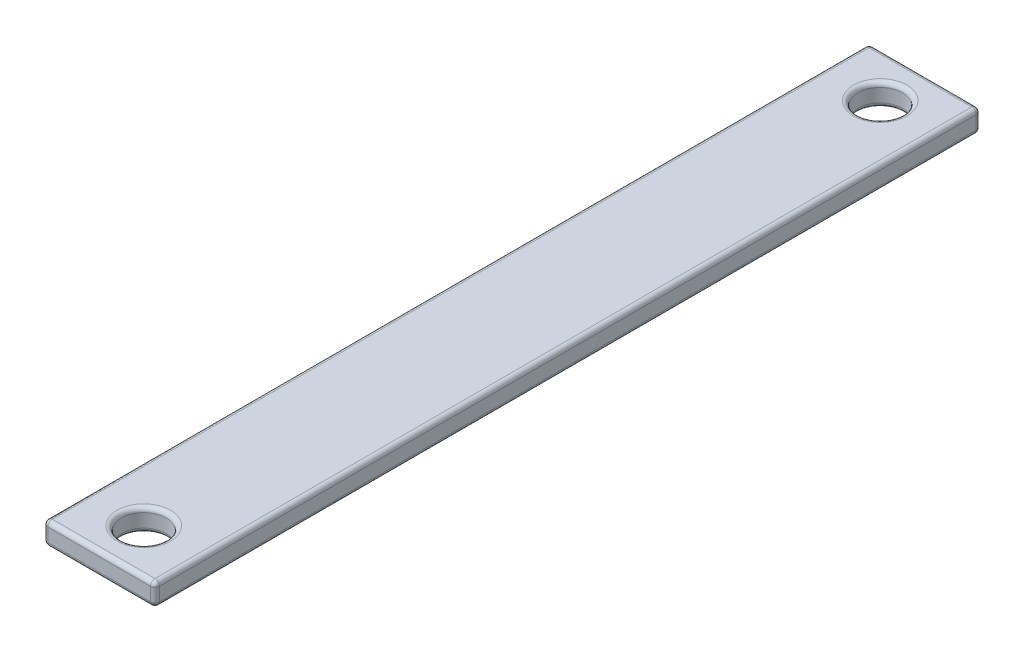
from build123d import *

# Parameters (mm, degrees)
CROQUIS1_W              = 50
CROQUIS1_H              = 370
CROQUIS1_R              = 10
SALIENTE_EXTRUIR1_DEPTH = 10
REDONDEO1_R             = 2
REDONDEO2_R             = 2


with BuildPart() as part:
    # Croquis1 → Saliente-Extruir1 (new body)
    with BuildSketch(Plane(origin=(0, 0, 0), x_dir=(1, 0, 0), z_dir=(0, 1, 0))):
        Rectangle(CROQUIS1_W, CROQUIS1_H)
        with Locations(Location((0, 165, 0), (0, 0, 270))):
            Circle(CROQUIS1_R, mode=Mode.SUBTRACT)
        with Locations(Location((0, -165, 0), (0, 0, 90))):
            Circle(CROQUIS1_R, mode=Mode.SUBTRACT)
    extrude(amount=SALIENTE_EXTRUIR1_DEPTH)

    # Redondeo1
    redondeo1_edges = [part.edges().sort_by_distance(p)[0] for p in [
        (0, 0, -175),
        (0, 10, -175),
        (-25, 10, 0),
        (0, 0, 175),
        (0, 10, 175),
        (0, 10, 185),
        (25, 10, 0),
        (0, 0, 185),
        (-25, 0, 0),
        (0, 0, -185),
        (25, 0, 0),
        (0, 10, -185),
    ]]
    fillet(redondeo1_edges, radius=REDONDEO1_R)

    # Redondeo2
    # the kernel refuses this fillet: 2 mm, written as the material it takes off along each edge
    with BuildSketch(Plane(origin=(-23, 8, -183), x_dir=(0, 0, -1), z_dir=(-1, 0, 0))) as redondeo2_piece_1_section:
        Polygon((0, 0), (REDONDEO2_R, 0), (REDONDEO2_R, -REDONDEO2_R), (0, -REDONDEO2_R), align=None)
    redondeo2_piece_1 = extrude(amount=REDONDEO2_R, mode=Mode.PRIVATE)
    redondeo2_piece_1 = redondeo2_piece_1 - Plane(origin=(-23, 8, -183), x_dir=(0, -0.7071067811865475, 0.7071067811865475), z_dir=(-1, 0, 0)) * Sphere(REDONDEO2_R, mode=Mode.PRIVATE)
    add(redondeo2_piece_1, mode=Mode.SUBTRACT)
    with BuildSketch(Plane(origin=(23, 8, -183), x_dir=(0, 0, -1), z_dir=(1, 0, 0))) as redondeo2_piece_2_section:
        Polygon((0, 0), (REDONDEO2_R, 0), (REDONDEO2_R, REDONDEO2_R), (0, REDONDEO2_R), align=None)
    redondeo2_piece_2 = extrude(amount=REDONDEO2_R, mode=Mode.PRIVATE)
    redondeo2_piece_2 = redondeo2_piece_2 - Plane(origin=(23, 8, -183), x_dir=(0, -0.7071067811865475, 0.7071067811865475), z_dir=(1, 0, 0)) * Sphere(REDONDEO2_R, mode=Mode.PRIVATE)
    add(redondeo2_piece_2, mode=Mode.SUBTRACT)
    with BuildSketch(Plane(origin=(-23, 8, 183), x_dir=(-1, 0, 0), z_dir=(0, 0, 1))) as redondeo2_piece_3_section:
        Polygon((0, 0), (REDONDEO2_R, 0), (REDONDEO2_R, -REDONDEO2_R), (0, -REDONDEO2_R), align=None)
    redondeo2_piece_3 = extrude(amount=REDONDEO2_R, mode=Mode.PRIVATE)
    redondeo2_piece_3 = redondeo2_piece_3 - Plane(origin=(-23, 8, 183), x_dir=(0.7071067811865475, -0.7071067811865475, 0), z_dir=(0, 0, 1)) * Sphere(REDONDEO2_R, mode=Mode.PRIVATE)
    add(redondeo2_piece_3, mode=Mode.SUBTRACT)
    with BuildSketch(Plane(origin=(23, 8, 183), x_dir=(1, 0, 0), z_dir=(0, 0, 1))) as redondeo2_piece_4_section:
        Polygon((0, 0), (REDONDEO2_R, 0), (REDONDEO2_R, REDONDEO2_R), (0, REDONDEO2_R), align=None)
    redondeo2_piece_4 = extrude(amount=REDONDEO2_R, mode=Mode.PRIVATE)
    redondeo2_piece_4 = redondeo2_piece_4 - Plane(origin=(23, 8, 183), x_dir=(-0.7071067811865475, -0.7071067811865475, 0), z_dir=(0, 0, 1)) * Sphere(REDONDEO2_R, mode=Mode.PRIVATE)
    add(redondeo2_piece_4, mode=Mode.SUBTRACT)
    with BuildSketch(Plane(origin=(23, 2, 183), x_dir=(1, 0, 0), z_dir=(0, 0, 1))) as redondeo2_piece_5_section:
        Polygon((0, 0), (REDONDEO2_R, 0), (REDONDEO2_R, -REDONDEO2_R), (0, -REDONDEO2_R), align=None)
    redondeo2_piece_5 = extrude(amount=REDONDEO2_R, mode=Mode.PRIVATE)
    redondeo2_piece_5 = redondeo2_piece_5 - Plane(origin=(23, 2, 183), x_dir=(-0.7071067811865475, 0.7071067811865475, 0), z_dir=(0, 0, 1)) * Sphere(REDONDEO2_R, mode=Mode.PRIVATE)
    add(redondeo2_piece_5, mode=Mode.SUBTRACT)
    with BuildSketch(Plane(origin=(-23, 2, 183), x_dir=(-1, 0, 0), z_dir=(0, 0, 1))) as redondeo2_piece_6_section:
        Polygon((0, 0), (REDONDEO2_R, 0), (REDONDEO2_R, REDONDEO2_R), (0, REDONDEO2_R), align=None)
    redondeo2_piece_6 = extrude(amount=REDONDEO2_R, mode=Mode.PRIVATE)
    redondeo2_piece_6 = redondeo2_piece_6 - Plane(origin=(-23, 2, 183), x_dir=(0.7071067811865475, 0.7071067811865475, 0), z_dir=(0, 0, 1)) * Sphere(REDONDEO2_R, mode=Mode.PRIVATE)
    add(redondeo2_piece_6, mode=Mode.SUBTRACT)
    with BuildSketch(Plane(origin=(23, 2, -183), x_dir=(0, 0, -1), z_dir=(1, 0, 0))) as redondeo2_piece_7_section:
        Polygon((0, 0), (REDONDEO2_R, 0), (REDONDEO2_R, -REDONDEO2_R), (0, -REDONDEO2_R), align=None)
    redondeo2_piece_7 = extrude(amount=REDONDEO2_R, mode=Mode.PRIVATE)
    redondeo2_piece_7 = redondeo2_piece_7 - Plane(origin=(23, 2, -183), x_dir=(0, 0.7071067811865475, 0.7071067811865475), z_dir=(1, 0, 0)) * Sphere(REDONDEO2_R, mode=Mode.PRIVATE)
    add(redondeo2_piece_7, mode=Mode.SUBTRACT)
    with BuildSketch(Plane(origin=(-23, 2, -183), x_dir=(0, 0, -1), z_dir=(-1, 0, 0))) as redondeo2_piece_8_section:
        Polygon((0, 0), (REDONDEO2_R, 0), (REDONDEO2_R, REDONDEO2_R), (0, REDONDEO2_R), align=None)
    redondeo2_piece_8 = extrude(amount=REDONDEO2_R, mode=Mode.PRIVATE)
    redondeo2_piece_8 = redondeo2_piece_8 - Plane(origin=(-23, 2, -183), x_dir=(0, 0.7071067811865475, 0.7071067811865475), z_dir=(-1, 0, 0)) * Sphere(REDONDEO2_R, mode=Mode.PRIVATE)
    add(redondeo2_piece_8, mode=Mode.SUBTRACT)
    with BuildSketch(Plane(origin=(25, 2, 185), x_dir=(-1, 0, 0), z_dir=(0, 1, 0)), Plane(origin=(25, 2, -185), x_dir=(0, 0, 1), z_dir=(0, 1, 0))) as redondeo2_piece_9:
        with BuildLine():
            CenterArc((REDONDEO2_R, -REDONDEO2_R), REDONDEO2_R, 90, 90)
            Line((0, -REDONDEO2_R), (0, 0))
            Line((0, 0), (REDONDEO2_R, 0))
        make_face()
    extrude(amount=6, mode=Mode.SUBTRACT)
    with BuildSketch(Plane(origin=(-25, 2, 185), x_dir=(1, 0, 0), z_dir=(0, 1, 0)), Plane(origin=(-25, 2, -185), x_dir=(0, 0, 1), z_dir=(0, 1, 0))) as redondeo2_piece_10:
        with BuildLine():
            CenterArc((REDONDEO2_R, REDONDEO2_R), REDONDEO2_R, 180, 90)
            Line((0, REDONDEO2_R), (0, 0))
            Line((0, 0), (REDONDEO2_R, 0))
        make_face()
    extrude(amount=6, mode=Mode.SUBTRACT)


solid = part.part
